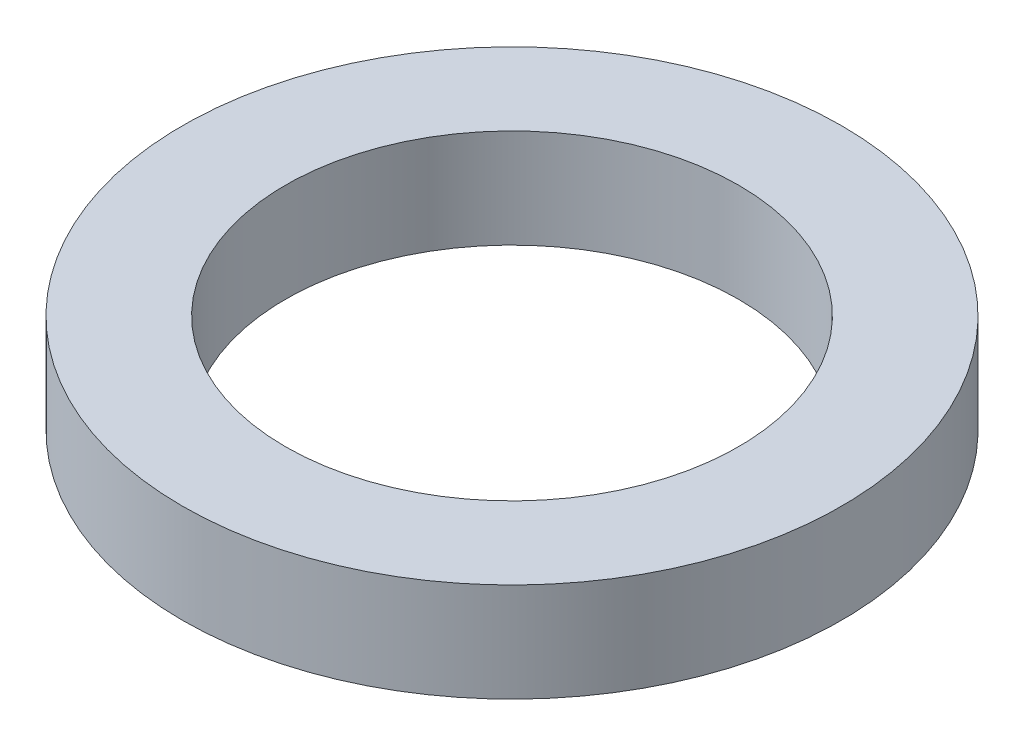
from build123d import *

# Parameters (mm, degrees)
SKETCH1_R           = 40
BOSS_EXTRUDE1_DEPTH = 12
SKETCH2_R           = 27.5
CUT_EXTRUDE1_DEPTH  = 58.827329179


with BuildPart() as part:
    # Sketch1 → Boss-Extrude1 (new body)
    with BuildSketch(Plane(origin=(0, 0, 0), x_dir=(1, 0, 0), z_dir=(0, 1, 0))):
        Circle(SKETCH1_R)
    extrude(amount=BOSS_EXTRUDE1_DEPTH)

    # Sketch2 → Cut-Extrude1 (cut, through all)
    with BuildSketch(Plane(origin=(0, 0, 0), x_dir=(1, 0, 0), z_dir=(0, 1, 0))):
        Circle(SKETCH2_R)
    extrude(amount=CUT_EXTRUDE1_DEPTH, mode=Mode.SUBTRACT)


solid = part.part
